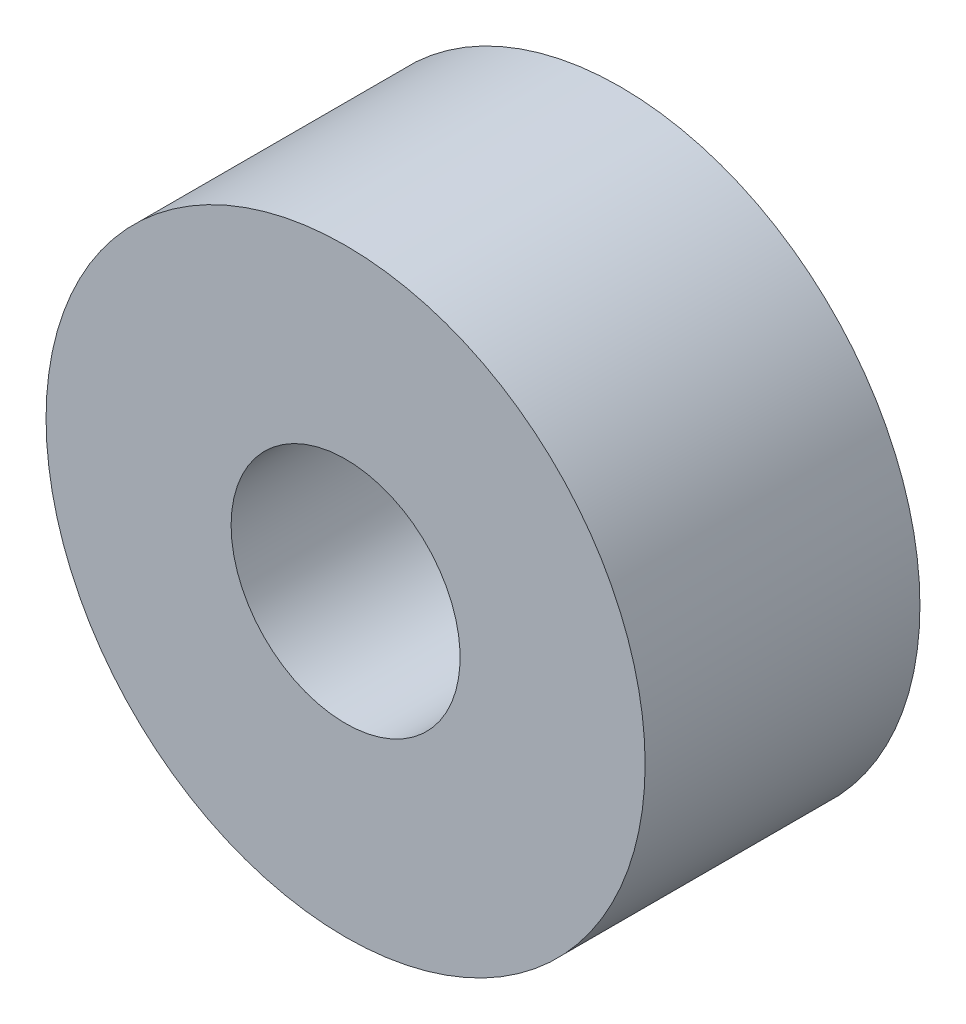
from build123d import *

# Parameters (mm, degrees)
SKETCH1_R           = 10.38225
SKETCH1_R_2         = 3.96875
BOSS_EXTRUDE1_DEPTH = 9.525


with BuildPart() as part:
    # Sketch1 → Boss-Extrude1 (new body)
    with BuildSketch(Plane.XY):
        Circle(SKETCH1_R)
        Circle(SKETCH1_R_2, mode=Mode.SUBTRACT)
    extrude(amount=BOSS_EXTRUDE1_DEPTH)


solid = part.part
